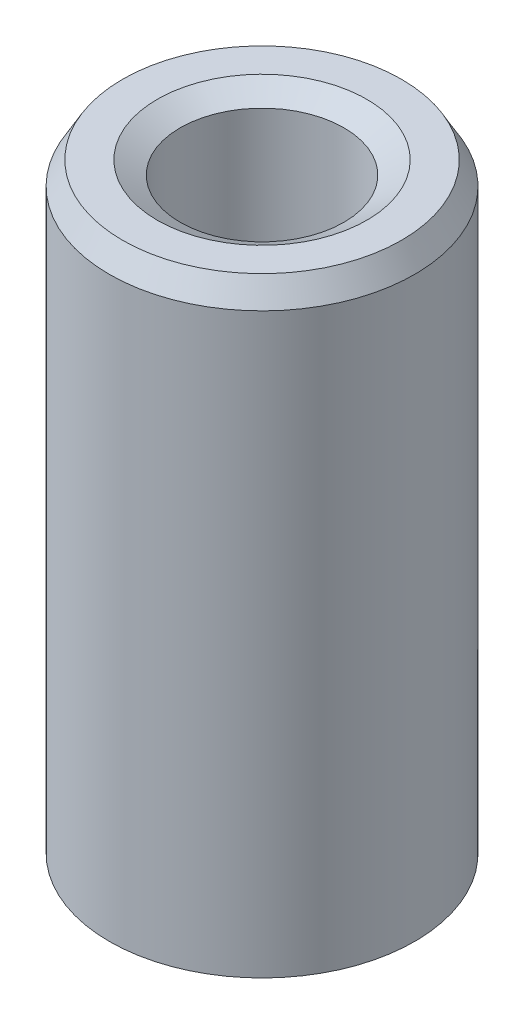
from build123d import *
from OCP.BRepFilletAPI import BRepFilletAPI_MakeChamfer

# Parameters (mm, degrees)
SKETCH1_R           = 15
BOSS_EXTRUDE1_DEPTH = 60.296545634
SKETCH2_R           = 8.044409457
CUT_EXTRUDE1_DEPTH  = 64.919272644
CHAMFER1_SIZE       = 2.248915202
CHAMFER1_SIZE2      = 1.298411797


with BuildPart() as part:
    # Sketch1 → Boss-Extrude1 (new body)
    with BuildSketch(Plane(origin=(0, 0, 0), x_dir=(1, 0, 0), z_dir=(0, 1, 0))):
        Circle(SKETCH1_R)
    extrude(amount=BOSS_EXTRUDE1_DEPTH)

    # Sketch2 → Cut-Extrude1 (cut, through all)
    with BuildSketch(Plane(origin=(0, 0, 0), x_dir=(1, 0, 0), z_dir=(0, 1, 0))):
        Circle(SKETCH2_R)
    extrude(amount=CUT_EXTRUDE1_DEPTH, mode=Mode.SUBTRACT)

    # Chamfer1: one chamfer whose edges measure the first distance from different faces: ONE call of the kernel's chamfer builder (chamfer() names one face for all edges)
    chamfer1_edges_1 = [part.edges().sort_by_distance(p)[0] for p in [
        (-8.044409457, 60.296545634, 0),
    ]]
    chamfer1_side_1 = [part.faces().sort_by_distance(p)[0] for p in [
        (-14.575735931, 60.296545634, 0),
    ]]
    chamfer1_edges_2 = [part.edges().sort_by_distance(p)[0] for p in [
        (-8.044409457, 0, 0),
    ]]
    chamfer1_side_2 = [part.faces().sort_by_distance(p)[0] for p in [
        (-8.044409457, 30.148272817, 0),
    ]]
    chamfer1_edges_3 = [part.edges().sort_by_distance(p)[0] for p in [
        (-15, 0, 0),
    ]]
    chamfer1_side_3 = [part.faces().sort_by_distance(p)[0] for p in [
        (-14.575735931, 0, 0),
    ]]
    chamfer1_edges_4 = [part.edges().sort_by_distance(p)[0] for p in [
        (-15, 60.296545634, 0),
    ]]
    chamfer1_side_4 = [part.faces().sort_by_distance(p)[0] for p in [
        (-15, 30.148272817, 0),
    ]]
    chamfer1 = BRepFilletAPI_MakeChamfer(part.part.solid().wrapped)
    for e in chamfer1_edges_1:
        chamfer1.Add(CHAMFER1_SIZE, CHAMFER1_SIZE2, e.wrapped, chamfer1_side_1[0].wrapped)  # the first distance lies on this face
    for e in chamfer1_edges_2:
        chamfer1.Add(CHAMFER1_SIZE, CHAMFER1_SIZE2, e.wrapped, chamfer1_side_2[0].wrapped)  # the first distance lies on this face
    for e in chamfer1_edges_3:
        chamfer1.Add(CHAMFER1_SIZE, CHAMFER1_SIZE2, e.wrapped, chamfer1_side_3[0].wrapped)  # the first distance lies on this face
    for e in chamfer1_edges_4:
        chamfer1.Add(CHAMFER1_SIZE, CHAMFER1_SIZE2, e.wrapped, chamfer1_side_4[0].wrapped)  # the first distance lies on this face
    add(Compound.cast(chamfer1.Shape()), mode=Mode.REPLACE)


solid = part.part
